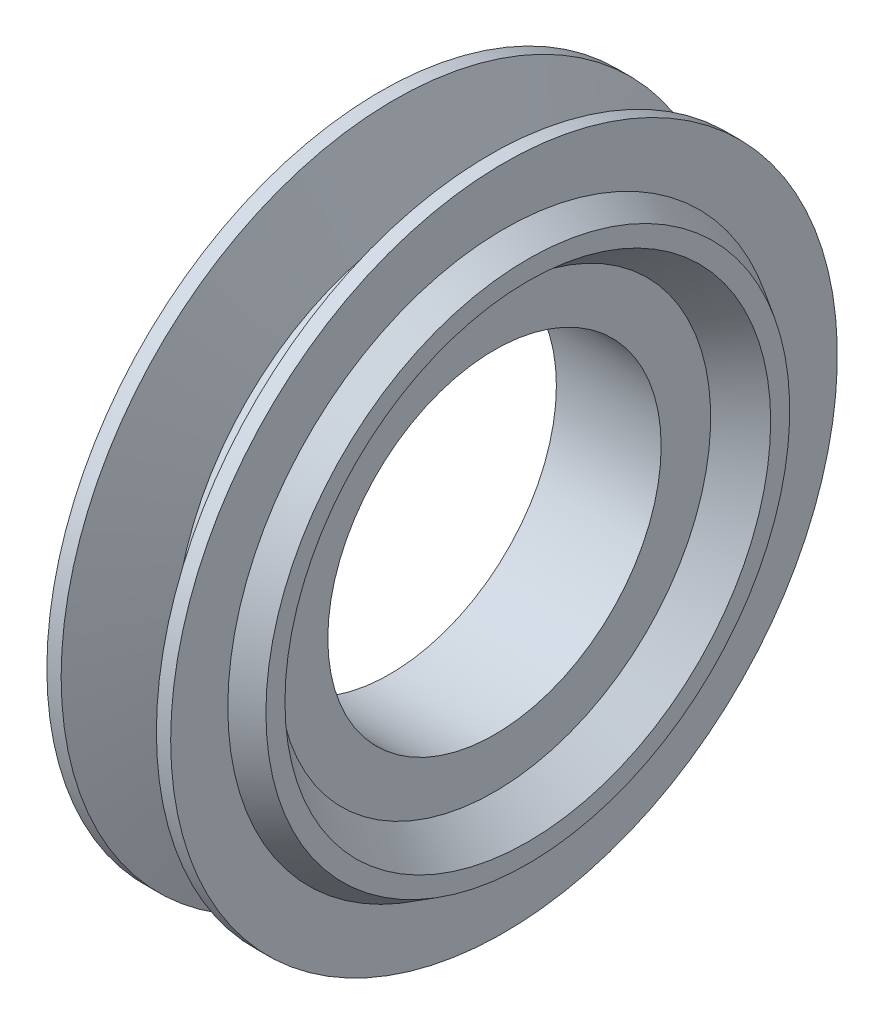
from build123d import *

# Parameters (mm, degrees)
SKETCH_2_R          = 17.5
CUT_EXTRUDE_1_DEPTH = 52.577611422
SKETCH_4_W          = 5.67471706
SKETCH_4_H          = 4.873840026


with BuildPart() as part:
    # Эскиз1 → Повернуть1 (revolve)
    with BuildSketch(Plane.XY):
        Polygon((5.5, 0), (5.5, 22.7), (9, 25.5), (9, 27.5), (6.5, 29), (6.5, 35), (5, 35), (1, 22.7), (-1, 22.7), (-5, 35), (-6.5, 35), (-6.5, 29), (-9, 27.5), (-9, 25.5), (-5.5, 22.7), (-5.5, 0), align=None)
    revolve(axis=Axis((-55.549199464, 0, 0), (1, 0, 0)))

    # Эскиз2 → Вырез-Вытянуть1 (cut, through all)
    with BuildSketch(Plane(origin=(5.5, 0, 0), x_dir=(0, 0, -1), z_dir=(1, 0, 0))):
        Circle(SKETCH_2_R)
    extrude(amount=-CUT_EXTRUDE_1_DEPTH, mode=Mode.SUBTRACT)

    # Эскиз4 → Повернуть2 (revolve)
    with BuildSketch(Plane.XY):
        with Locations((0, 23.563079987)):
            Rectangle(SKETCH_4_W, SKETCH_4_H)
    revolve(axis=Axis((-55.549199464, 0, 0), (1, 0, 0)))


solid = part.part
